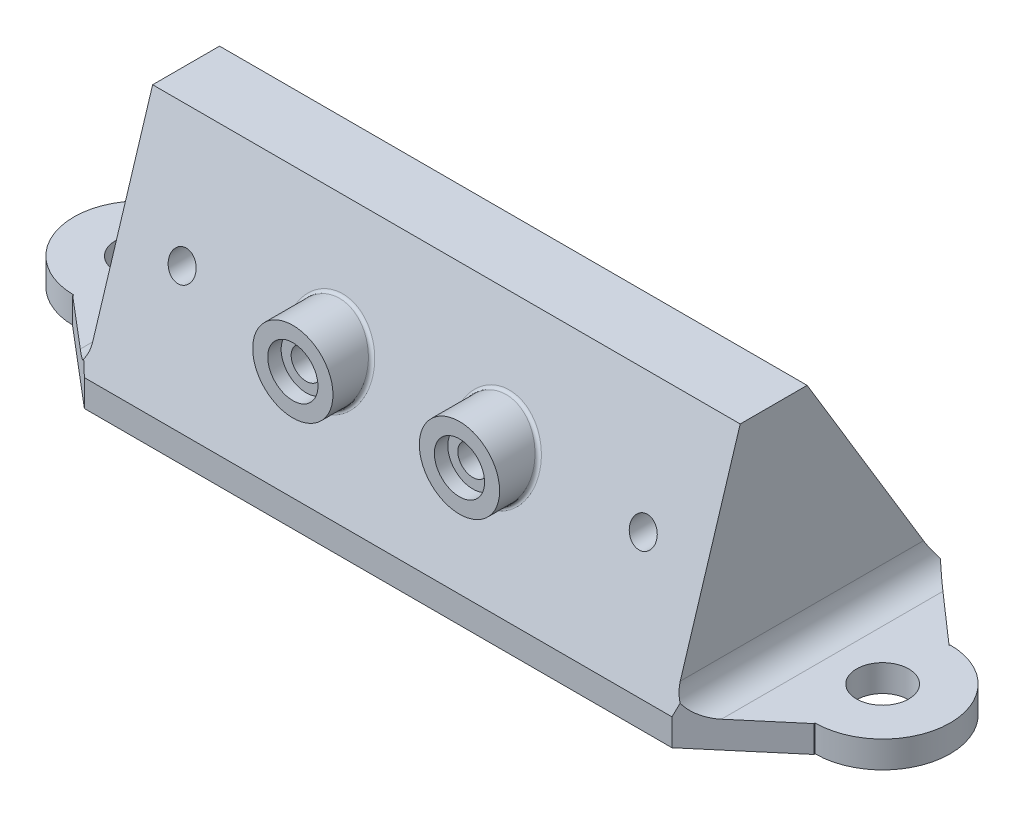
from build123d import *

# Parameters (mm, degrees)
SKETCH1_W            = 79.8
SKETCH1_H            = 32.8
BOSS_EXTRUDE1_DEPTH  = 10
SKETCH3_W            = 79.8
SKETCH3_H            = 19.8
SKETCH3_H_2          = 10.2
SKETCH3_H_3          = 10
BOSS_EXTRUDE3_DEPTH  = 4
BOSS_EXTRUDE4_DEPTH  = 4
SKETCH5_R            = 3.9
BOSS_EXTRUDE5_DEPTH  = 4
FILLET3_R            = 4
FILLET4_R            = 1
BOSS_EXTRUDE9_DEPTH  = 79.8
SKETCH6_R            = 2.25
SKETCH6_R_2          = 2
CUT_EXTRUDE1_DEPTH   = 38.2
BOSS_EXTRUDE10_REACH = 80.553
SKETCH12_R           = 6
SKETCH12_R_2         = 2.25
BOSS_EXTRUDE11_START = 2
SKETCH14_R           = 6
SKETCH14_R_2         = 3.75
BOSS_EXTRUDE11_DEPTH = 2
FILLET5_R            = 0.5


with BuildPart() as part:
    # Sketch1 → Boss-Extrude1 (new body)
    with BuildSketch(Plane.XY):
        Rectangle(SKETCH1_W, SKETCH1_H)
    extrude(amount=BOSS_EXTRUDE1_DEPTH)

    # Sketch3 → Boss-Extrude3 (add)
    with BuildSketch(Plane.XZ.offset(16.4)):
        with Locations((0, -9.9)):
            Rectangle(SKETCH3_W, SKETCH3_H)
        with Locations((0, 15.1)):
            Rectangle(SKETCH3_W, SKETCH3_H_2)
        with Locations((0, 5)):
            Rectangle(SKETCH3_W, SKETCH3_H_3)
    extrude(amount=BOSS_EXTRUDE3_DEPTH)

    # Sketch4 → Boss-Extrude4 (add)
    with BuildSketch(Plane.ZY.offset(39.9)):
        Polygon((10, 16.4), (20.2, -16.4), (20.2, -20.4), (-19.8, -20.4), (-19.8, -16.4), (0, 16.4), align=None)
    boss_extrude4 = extrude(amount=BOSS_EXTRUDE4_DEPTH)

    # Mirror1: Boss-Extrude4 across plane
    add(boss_extrude4.mirror(Plane(origin=(0, 0, 0), x_dir=(0, 0, 1), z_dir=(1, 0, 0))))

    # Sketch5 → Boss-Extrude5 (add)
    with BuildSketch(Plane.XZ.offset(20.4)):
        with BuildLine():
            Line((43.9, 20.2), (43.9, -19.8))
            Line((43.9, -19.8), (55.386672933, -9.72660048))
            Line((55.386672933, -9.72660048), (55.386672933, -9.892664239))
            ThreePointArc((55.386672933, -9.892664239), (65.479337172, 0.2), (55.386672933, 10.292664239))
            Line((55.386672933, 10.292664239), (55.386672933, 10.458727998))
            Line((55.386672933, 10.458727998), (43.9, 20.2))
        make_face()
        with Locations(Location((55.386672933, 0.2, 0), (0, 0, 270))):
            Circle(SKETCH5_R, mode=Mode.SUBTRACT)
    boss_extrude5 = extrude(amount=-BOSS_EXTRUDE5_DEPTH)

    # Mirror2: Boss-Extrude5 across plane
    add(boss_extrude5.mirror(Plane(origin=(0, 0, 0), x_dir=(0, 0, 1), z_dir=(1, 0, 0))))

    # Fillet3
    # the kernel refuses this fillet: 4 mm, written as the material it adds along each edge
    with BuildSketch(Plane(origin=(43.9, -16.4, 30.2), x_dir=(1, 0, 0), z_dir=(0, 0, -1))) as fillet3_piece_1_section:
        with BuildLine():
            CenterArc((FILLET3_R, -FILLET3_R), FILLET3_R, 90, 90)
            Line((0, -FILLET3_R), (0, 0))
            Line((0, 0), (FILLET3_R, 0))
        make_face()
    fillet3_piece_1 = extrude(amount=60, mode=Mode.PRIVATE)
    fillet3_piece_1 = split(fillet3_piece_1, bisect_by=Plane(origin=(54.225128719, -15.491118341, 11.44377547), z_dir=(-0.6467845633993831, 0, -0.7626727532489078)), keep=Keep.TOP, mode=Mode.PRIVATE)
    fillet3_piece_1 = split(fillet3_piece_1, bisect_by=Plane(origin=(54.366477736, -15.491118341, -10.621275019), z_dir=(-0.659340550917199, 0, 0.7518444240108485)), keep=Keep.TOP, mode=Mode.PRIVATE)
    fillet3_piece_1 = split(fillet3_piece_1, bisect_by=Plane(origin=(44.781661859, -6.837280787, -14.027382914), z_dir=(0, -0.5167969163836084, 0.8561080231001189)), keep=Keep.TOP, mode=Mode.PRIVATE)
    fillet3_piece_1 = split(fillet3_piece_1, bisect_by=Plane(origin=(44.781661859, -9.930876549, 18.18826039), z_dir=(0, -0.29694857943139136, -0.9548934711127094)), keep=Keep.TOP, mode=Mode.PRIVATE)
    add(fillet3_piece_1)
    with BuildSketch(Plane(origin=(-43.9, -16.4, 30.2), x_dir=(-1, 0, 0), z_dir=(0, 0, -1))) as fillet3_piece_2_section:
        with BuildLine():
            CenterArc((FILLET3_R, FILLET3_R), FILLET3_R, 180, 90)
            Line((0, FILLET3_R), (0, 0))
            Line((0, 0), (FILLET3_R, 0))
        make_face()
    fillet3_piece_2 = extrude(amount=60, mode=Mode.PRIVATE)
    fillet3_piece_2 = split(fillet3_piece_2, bisect_by=Plane(origin=(-54.366477736, -15.491118341, -10.621275019), z_dir=(0.659340550917199, 0, 0.7518444240108485)), keep=Keep.TOP, mode=Mode.PRIVATE)
    fillet3_piece_2 = split(fillet3_piece_2, bisect_by=Plane(origin=(-44.781661859, -6.837280787, -14.027382914), z_dir=(0, -0.5167969163836084, 0.8561080231001189)), keep=Keep.TOP, mode=Mode.PRIVATE)
    fillet3_piece_2 = split(fillet3_piece_2, bisect_by=Plane(origin=(-54.225128719, -15.491118341, 11.44377547), z_dir=(0.6467845633993831, 0, -0.7626727532489078)), keep=Keep.TOP, mode=Mode.PRIVATE)
    fillet3_piece_2 = split(fillet3_piece_2, bisect_by=Plane(origin=(-44.781661859, -9.930876549, 18.18826039), z_dir=(0, -0.29694857943139136, -0.9548934711127094)), keep=Keep.TOP, mode=Mode.PRIVATE)
    add(fillet3_piece_2)

    # Fillet4
    fillet4_edges = [part.edges().sort_by_distance(p)[0] for p in [
        (0, -16.4, 0),
    ]]
    fillet(fillet4_edges, radius=FILLET4_R)

    # Sketch11 → Boss-Extrude9 (add)
    with BuildSketch(Plane(origin=(-39.9, 0, 0), x_dir=(0, 0, -1), z_dir=(1, 0, 0))):
        Polygon((-20.2, -16.4), (-10, -16.4), (-10, 16.4), align=None)
    extrude(amount=BOSS_EXTRUDE9_DEPTH)

    # Sketch6 → Cut-Extrude1 (cut)
    with BuildSketch(Plane(origin=(0, 0, 0), x_dir=(-1, 0, 0), z_dir=(0, 0, -1))):
        with Locations((-12.45, 0.25)):
            Circle(SKETCH6_R)
        with Locations(Location((12.45, 0.25, 0), (0, 0, 90))):
            Circle(SKETCH6_R)
        with Locations((34.45, 0.2)):
            Circle(SKETCH6_R_2)
        with Locations(Location((-34.45, 0.2, 0), (0, 0, 90))):
            Circle(SKETCH6_R_2)
    extrude(amount=-CUT_EXTRUDE1_DEPTH, mode=Mode.SUBTRACT)

    # Boss-Extrude10: up to this plane
    boss_extrude10_end = Plane(origin=(-43.9, 16.4, 10), z_dir=(0, -0.29694857943139136, -0.9548934711127095))
    # Sketch12 → Boss-Extrude10 (add, up to the surface)
    with BuildSketch(Plane(origin=(0, 0, 18.5), x_dir=(-1, 0, 0), z_dir=(0, 0, -1)), mode=Mode.PRIVATE) as boss_extrude10_sk1:
        with Locations(Location((12.45, 0.25, 0), (0, 0, 270))):
            Circle(SKETCH12_R)
        with Locations((12.45, 0.25)):
            Circle(SKETCH12_R_2, mode=Mode.SUBTRACT)
    boss_extrude10_tool1 = split(extrude(boss_extrude10_sk1.sketch, amount=BOSS_EXTRUDE10_REACH, mode=Mode.PRIVATE), bisect_by=boss_extrude10_end, keep=Keep.BOTH, mode=Mode.PRIVATE)
    add(boss_extrude10_tool1.solids().sort_by_distance((-12.45, 6.080294, 18.5))[0])
    # Sketch12 → Boss-Extrude10 (add, up to the surface)
    with BuildSketch(Plane(origin=(0, 0, 18.5), x_dir=(-1, 0, 0), z_dir=(0, 0, -1)), mode=Mode.PRIVATE) as boss_extrude10_sk2:
        with Locations(Location((-12.45, 0.25, 0), (0, 0, 270))):
            Circle(SKETCH12_R)
        with Locations((-12.45, 0.25)):
            Circle(SKETCH12_R_2, mode=Mode.SUBTRACT)
    boss_extrude10_tool2 = split(extrude(boss_extrude10_sk2.sketch, amount=BOSS_EXTRUDE10_REACH, mode=Mode.PRIVATE), bisect_by=boss_extrude10_end, keep=Keep.BOTH, mode=Mode.PRIVATE)
    add(boss_extrude10_tool2.solids().sort_by_distance((12.45, 6.080294, 18.5))[0])

    # Sketch14 → Boss-Extrude11 (add)
    # profile 1 of 2: a face of its own
    with BuildSketch(Plane.XY.offset(18.5).offset(BOSS_EXTRUDE11_START)):
        with Locations((-12.45, 0.25)):
            Circle(SKETCH14_R)
        with Locations((-12.45, 0.25)):
            Circle(SKETCH14_R_2, mode=Mode.SUBTRACT)
    # profile 2 of 2: a face of its own
    with BuildSketch(Plane.XY.offset(18.5).offset(BOSS_EXTRUDE11_START)):
        with Locations((12.45, 0.25)):
            Circle(SKETCH14_R)
        with Locations((12.45, 0.25)):
            Circle(SKETCH14_R_2, mode=Mode.SUBTRACT)
    extrude(amount=-BOSS_EXTRUDE11_DEPTH)

    # Fillet5
    fillet5_edges = [part.edges().sort_by_distance(p)[0] for p in [
        (-12.449991171, 6.25, 13.156402439),
        (12.450008829, 6.25, 13.156402439),
    ]]
    fillet(fillet5_edges, radius=FILLET5_R)


solid = part.part
